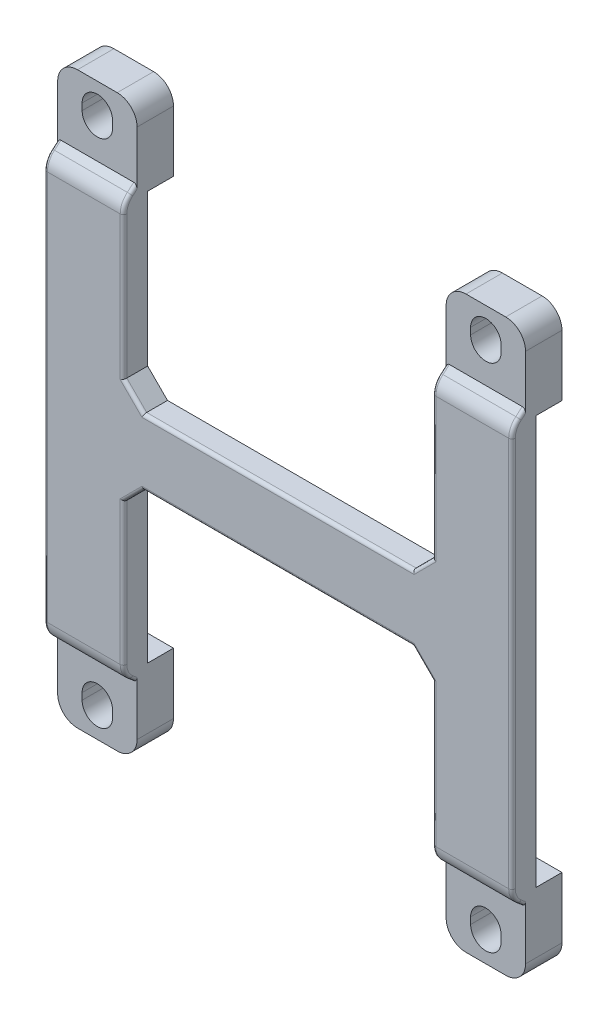
from build123d import *

# Parameters (mm, degrees)
BOSS_EXTRUDE1_DEPTH      = 3
BOSS_EXTRUDE1_DEPTH_BACK = 4.55
CUT_EXTRUDE1_DEPTH       = 3.9
CUT_EXTRUDE2_DEPTH       = 87.014737759
CHAMFER1_SIZE            = 3
FILLET1_R                = 3
FILLET2_R                = 3
FILLET3_R                = 0.5


with BuildPart() as part:
    # Sketch1 → Boss-Extrude1 (new, two sides: drawn at the far end of the back side and taken through both)
    with BuildSketch(Plane.XY.offset(-BOSS_EXTRUDE1_DEPTH_BACK)):
        Polygon((-32.872559152, 37.371494367), (-44.872559152, 37.371494367), (-44.872559152, -48.778505633), (-32.872559152, -48.778505633), (-32.872559152, -10.703505633), (13.827440848, -10.703505633), (13.827440848, -48.778505633), (25.827440848, -48.778505633), (25.827440848, 37.371494367), (13.827440848, 37.371494367), (13.827440848, -0.703505633), (-32.872559152, -0.703505633), align=None)
        with BuildLine():
            ThreePointArc((-36.572559152, 32.371494367), (-38.872559152, 30.071494367), (-41.172559152, 32.371494367))
            Line((-41.172559152, 32.371494367), (-41.172559152, 33.371494367))
            ThreePointArc((-41.172559152, 33.371494367), (-38.872559152, 35.671494367), (-36.572559152, 33.371494367))
            Line((-36.572559152, 33.371494367), (-36.572559152, 32.371494367))
        make_face(mode=Mode.SUBTRACT)
        with BuildLine():
            Line((-36.572559152, -43.778505633), (-36.572559152, -44.778505633))
            ThreePointArc((-36.572559152, -44.778505633), (-38.872559152, -47.078505633), (-41.172559152, -44.778505633))
            Line((-41.172559152, -44.778505633), (-41.172559152, -43.778505633))
            ThreePointArc((-41.172559152, -43.778505633), (-38.872559152, -41.478505633), (-36.572559152, -43.778505633))
        make_face(mode=Mode.SUBTRACT)
        with BuildLine():
            Line((17.527440848, 32.371494367), (17.527440848, 33.371494367))
            ThreePointArc((17.527440848, 33.371494367), (19.827440848, 35.671494367), (22.127440848, 33.371494367))
            Line((22.127440848, 33.371494367), (22.127440848, 32.371494367))
            ThreePointArc((22.127440848, 32.371494367), (19.827440848, 30.071494367), (17.527440848, 32.371494367))
        make_face(mode=Mode.SUBTRACT)
        with BuildLine():
            Line((22.127440848, -43.778505633), (22.127440848, -44.778505633))
            ThreePointArc((22.127440848, -44.778505633), (19.827440848, -47.078505633), (17.527440848, -44.778505633))
            Line((17.527440848, -44.778505633), (17.527440848, -43.778505633))
            ThreePointArc((17.527440848, -43.778505633), (19.827440848, -41.478505633), (22.127440848, -43.778505633))
        make_face(mode=Mode.SUBTRACT)
    extrude(amount=BOSS_EXTRUDE1_DEPTH + BOSS_EXTRUDE1_DEPTH_BACK)

    # Sketch5 → Cut-Extrude1 (cut)
    with BuildSketch(Plane(origin=(0, 0, -4.55), x_dir=(-1, 0, 0), z_dir=(0, 0, -1))):
        Polygon((-13.827440848, 25.171494367), (-25.827440848, 25.171494367), (-25.827440848, -36.569505633), (-13.827440848, -36.569505633), (-13.827440848, -10.703505633), (32.872559152, -10.703505633), (32.872559152, -36.569505633), (44.872559152, -36.569505633), (44.872559152, 25.171494367), (32.872559152, 25.171494367), (32.872559152, -0.703505633), (-13.827440848, -0.703505633), align=None)
    extrude(amount=-CUT_EXTRUDE1_DEPTH, mode=Mode.SUBTRACT)

    # Sketch6 → Cut-Extrude2 (cut, through all)
    with BuildSketch(Plane.ZY.offset(44.872559152)):
        Polygon((0.95, 26.891648611), (3, 25.171494367), (3, 37.371494367), (0.95, 37.371494367), align=None)
        Polygon((3, -48.778505633), (3, -36.578505633), (0.95, -38.298659877), (0.95, -48.778505633), align=None)
    extrude(amount=-CUT_EXTRUDE2_DEPTH, mode=Mode.SUBTRACT)

    # Chamfer1
    chamfer1_edges = [part.edges().sort_by_distance(p)[0] for p in [
        (-32.872559152, -10.703505633, 1.175),
        (-32.872559152, -0.703505633, 1.175),
        (13.827440848, -10.703505633, 1.175),
        (13.827440848, -0.703505633, 1.175),
    ]]
    chamfer(chamfer1_edges, length=CHAMFER1_SIZE)

    # Fillet1
    fillet1_edges = [part.edges().sort_by_distance(p)[0] for p in [
        (25.827440848, -48.778505633, -1.8),
        (13.827440848, -48.778505633, -1.8),
        (-32.872559152, -48.778505633, -1.8),
        (-44.872559152, -48.778505633, -1.8),
        (25.827440848, 37.371494367, -1.8),
        (13.827440848, 37.371494367, -1.8),
        (-32.872559152, 37.371494367, -1.8),
        (-44.872559152, 37.371494367, -1.8),
    ]]
    fillet(fillet1_edges, radius=FILLET1_R)

    # Fillet2
    fillet2_edges = [part.edges().sort_by_distance(p)[0] for p in [
        (19.827440848, -36.578505633, 3),
        (-38.872559152, -36.578505633, 3),
        (19.827440848, 25.171494367, 3),
        (-38.872559152, 25.171494367, 3),
    ]]
    fillet(fillet2_edges, radius=FILLET2_R)

    # Fillet3
    fillet3_edges = [part.edges().sort_by_distance(p)[0] for p in [
        (-32.872559152, -37.888187933, 1.439181415),
        (-32.872559152, -36.447437444, 2.718923361),
        (-44.872559152, 26.481176666, 1.439181415),
        (-44.872559152, 25.040426178, 2.718923361),
        (-44.872559152, -37.888187933, 1.439181415),
        (-44.872559152, -36.447437444, 2.718923361),
        (-32.872559152, 26.481176666, 1.439181415),
        (-32.872559152, 25.040426178, 2.718923361),
        (13.827440848, 26.481176666, 1.439181415),
        (13.827440848, 25.040426178, 2.718923361),
        (25.827440848, 26.481176666, 1.439181415),
        (25.827440848, 25.040426178, 2.718923361),
        (25.827440848, -37.888187933, 1.439181415),
        (25.827440848, -36.447437444, 2.718923361),
        (13.827440848, -37.888187933, 1.439181415),
        (13.827440848, -36.447437444, 2.718923361),
        (12.327440848, -12.203505633, 3),
        (-9.522559152, -10.703505633, 3),
        (-31.372559152, -12.203505633, 3),
        (-32.872559152, -24.441544146, 3),
        (-44.872559152, -5.703505633, 3),
        (-31.372559152, 0.796494367, 3),
        (-9.522559152, -0.703505633, 3),
        (12.327440848, 0.796494367, 3),
        (13.827440848, 13.03453288, 3),
        (25.827440848, -5.703505633, 3),
        (13.827440848, -24.441544146, 3),
    ]]
    fillet(fillet3_edges, radius=FILLET3_R)


solid = part.part
